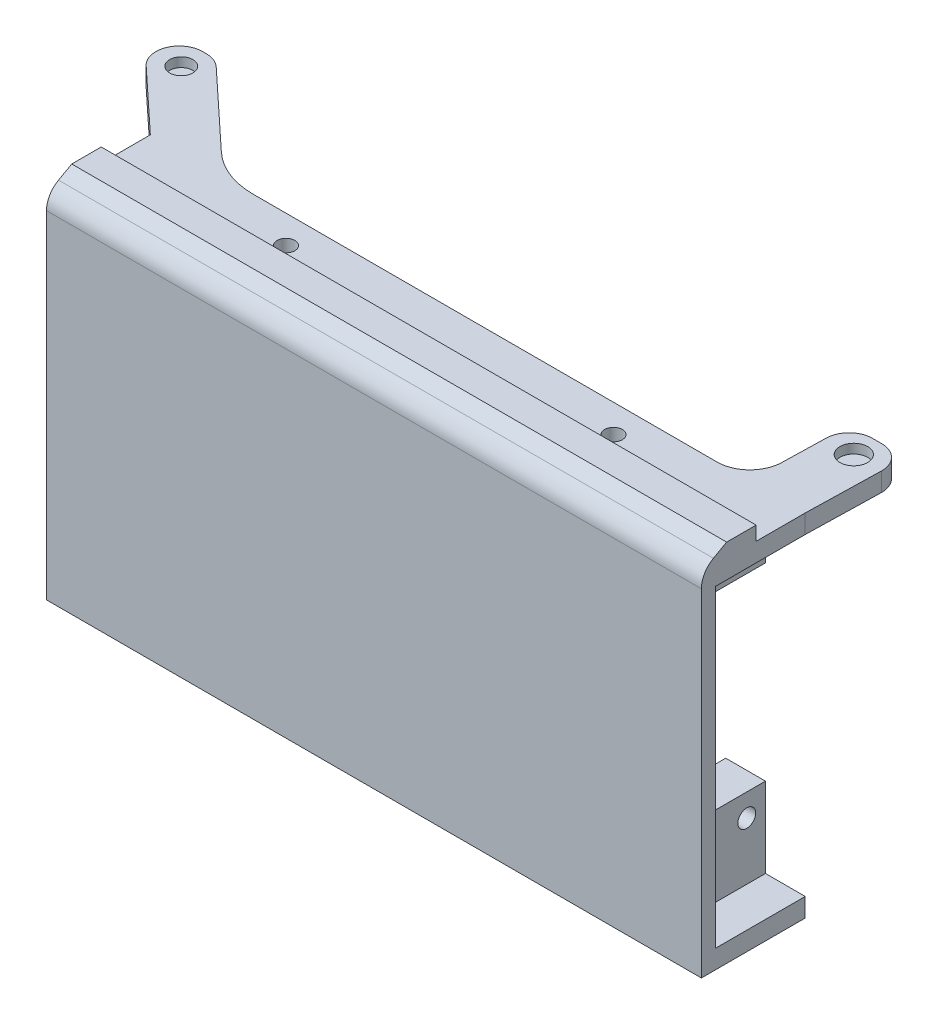
from build123d import *
from OCP.BRepFilletAPI import BRepFilletAPI_MakeChamfer

# Parameters (mm, degrees)
SKETCH1_W               = 140
SKETCH1_H               = 75
BOSS_EXTRUDE1_DEPTH     = 22.2
CUT_EXTRUDE1_DEPTH      = 19.2
CUT_EXTRUDE2_DEPTH      = 147.625679879
CUT_EXTRUDE2_DEPTH_BACK = 147.625679879
SKETCH3_R               = 1.9
CUT_EXTRUDE5_DEPTH      = 103.146169776
CUT_EXTRUDE5_DEPTH_BACK = 103.146169776
SKETCH9_R               = 1.9
BOSS_EXTRUDE6_DEPTH     = 4
FILLET2_R               = 5
BOSS_EXTRUDE10_DEPTH    = 140
FILLET5_R               = 5
SKETCH28_R              = 2.481859786
SKETCH28_R_2            = 2.963166916
CUT_EXTRUDE11_DEPTH     = 2
SKETCH27_R              = 4
SKETCH27_R_2            = 1.9
BOSS_EXTRUDE15_DEPTH    = 1.5
CHAMFER1_SIZE           = 1.5
CHAMFER1_SIZE_2         = 1
SKETCH29_R              = 4.5
SKETCH29_R_2            = 1.9
BOSS_EXTRUDE16_DEPTH    = 5.5
FILLET7_R               = 2


with BuildPart() as part:
    # Sketch1 → Boss-Extrude1 (new body)
    with BuildSketch(Plane.XY):
        Rectangle(SKETCH1_W, SKETCH1_H)
    extrude(amount=BOSS_EXTRUDE1_DEPTH)

    # Sketch2 → Cut-Extrude1 (cut)
    with BuildSketch(Plane(origin=(0, 0, 0), x_dir=(-1, 0, 0), z_dir=(0, 0, -1))):
        Polygon((-61.5, 24), (-53, 24), (-53, 33.5), (53, 33.5), (53, 24), (61.5, 24), (61.5, 33.5), (70, 33.5), (70, 20.2), (70, -20.2), (70, -33.5), (61.5, -33.5), (61.5, -16.4), (53, -16.4), (53, -33.5), (-53, -33.5), (-53, -16.4), (-61.5, -16.4), (-61.5, -33.5), (-70, -33.5), (-70, -20), (-70, 20), (-70, 33.5), (-61.5, 33.5), align=None)
    extrude(amount=-CUT_EXTRUDE1_DEPTH, mode=Mode.SUBTRACT)

    # Sketch3 → Cut-Extrude2 (cut, two sides: drawn at the far end of the back side and taken through both)
    with BuildSketch(Plane.ZY.offset(70).offset(-CUT_EXTRUDE2_DEPTH_BACK)):
        with Locations((14, 28.25)):
            Circle(SKETCH3_R)
        with Locations((4, 28.25)):
            Circle(SKETCH3_R)
        with Locations((4, -21.25)):
            Circle(SKETCH3_R)
        with Locations((14, -21.25)):
            Circle(SKETCH3_R)
    extrude(amount=CUT_EXTRUDE2_DEPTH + CUT_EXTRUDE2_DEPTH_BACK, mode=Mode.SUBTRACT)

    # Sketch9 → Cut-Extrude5 (cut, two sides: drawn at the far end of the back side and taken through both)
    with BuildSketch(Plane(origin=(0, -33.5, 0), x_dir=(1, 0, 0), z_dir=(0, 1, 0)).offset(-CUT_EXTRUDE5_DEPTH_BACK)):
        with Locations(Location((35, -6, 0), (0, 0, 270))):
            Circle(SKETCH9_R)
        with Locations(Location((-35, -6, 0), (0, 0, 90))):
            Circle(SKETCH9_R)
    extrude(amount=CUT_EXTRUDE5_DEPTH + CUT_EXTRUDE5_DEPTH_BACK, mode=Mode.SUBTRACT)

    # Sketch14 → Boss-Extrude6 (add)
    with BuildSketch(Plane(origin=(0, 37.5, 0), x_dir=(1, 0, 0), z_dir=(0, 1, 0))):
        with BuildLine():
            Line((-92.519742911, 21), (-70, 0))
            Line((-70, 0), (-48.085259489, 0))
            ThreePointArc((-48.085259489, 0), (-54.053646754, 1.133133727), (-59.191444218, 4.374842509))
            Line((-59.191444218, 4.374842509), (-77.019742911, 21))
            Line((-77.019742911, 21), (-92.519742911, 21))
        make_face()
        with BuildLine():
            Line((51.164682821, 0), (70, 0))
            Line((70, 0), (70.5, 21))
            Line((70.5, 21), (58.5, 21))
            Line((58.5, 21), (58.162699537, 6.833380554))
            ThreePointArc((58.162699537, 6.833380554), (56.055166635, 1.991690099), (51.164682821, 0))
        make_face()
    extrude(amount=-BOSS_EXTRUDE6_DEPTH)

    # Fillet2
    fillet2_edges = [part.edges().sort_by_distance(p)[0] for p in [
        (-92.519742911, 35.5, -21),
        (-77.019742911, 35.5, -21),
        (58.5, 35.5, -21),
        (70.5, 35.5, -21),
    ]]
    fillet(fillet2_edges, radius=FILLET2_R)

    # Sketch19 → Boss-Extrude10 (add)
    with BuildSketch(Plane.ZY.offset(70)):
        Polygon((10.5, 37.5), (22.2, 37.5), (16.799018003, 40.5), (10.5, 40.5), align=None)
    extrude(amount=-BOSS_EXTRUDE10_DEPTH)

    # Fillet5
    fillet5_edges = [part.edges().sort_by_distance(p)[0] for p in [
        (0, 37.5, 22.2),
    ]]
    fillet(fillet5_edges, radius=FILLET5_R)

    # Sketch28 → Cut-Extrude11 (cut)
    with BuildSketch(Plane(origin=(0, 37.5, 0), x_dir=(1, 0, 0), z_dir=(0, 1, 0))):
        with Locations(Location((-79.386619677, 16, 0), (0, 0, 270))):
            Circle(SKETCH28_R)
        with Locations(Location((64.379251942, 16, 0), (0, 0, 270))):
            Circle(SKETCH28_R_2)
    extrude(amount=-CUT_EXTRUDE11_DEPTH, mode=Mode.SUBTRACT)

    # Sketch27 → Boss-Extrude15 (add)
    # profile 1 of 2: a face of its own
    with BuildSketch(Plane(origin=(0, -33.5, 0), x_dir=(1, 0, 0), z_dir=(0, 1, 0))):
        with Locations(Location((35, -6, 0), (0, 0, 90))):
            Circle(SKETCH27_R)
        with Locations(Location((35, -6, 0), (0, 0, 270))):
            Circle(SKETCH27_R_2, mode=Mode.SUBTRACT)
    # profile 2 of 2: a face of its own
    with BuildSketch(Plane(origin=(0, -33.5, 0), x_dir=(1, 0, 0), z_dir=(0, 1, 0))):
        with Locations(Location((-35, -6, 0), (0, 0, 90))):
            Circle(SKETCH27_R)
        with Locations(Location((-35, -6, 0), (0, 0, 270))):
            Circle(SKETCH27_R_2, mode=Mode.SUBTRACT)
    extrude(amount=BOSS_EXTRUDE15_DEPTH)

    # Chamfer1
    chamfer1_edges_1 = [part.edges().sort_by_distance(p)[0] for p in [
        (35, -32, 10),
    ]]
    chamfer1_side_1 = [part.faces().sort_by_distance(p)[0] for p in [
        (35, -32.02, 10),
    ]]
    chamfer1_edges_2 = [part.edges().sort_by_distance(p)[0] for p in [
        (-35, -32, 10),
    ]]
    chamfer1_side_2 = [part.faces().sort_by_distance(p)[0] for p in [
        (-35, -32.02, 10),
    ]]
    chamfer1 = BRepFilletAPI_MakeChamfer(part.part.solid().wrapped)
    for e in chamfer1_edges_1:
        chamfer1.Add(CHAMFER1_SIZE - 0.0001, CHAMFER1_SIZE_2 - 0.0001, e.wrapped, chamfer1_side_1[0].wrapped)
    for e in chamfer1_edges_2:
        chamfer1.Add(CHAMFER1_SIZE - 0.0001, CHAMFER1_SIZE_2 - 0.0001, e.wrapped, chamfer1_side_2[0].wrapped)
    add(Compound.cast(chamfer1.Shape()), mode=Mode.REPLACE)  # a hair under: the kernel refuses the full size

    # Sketch29 → Boss-Extrude16 (add)
    # profile 1 of 2: a face of its own
    with BuildSketch(Plane(origin=(0, 0, 19.2), x_dir=(-1, 0, 0), z_dir=(0, 0, -1))):
        with Locations((0, 22.5)):
            Circle(SKETCH29_R)
        with Locations((0, 22.5)):
            Circle(SKETCH29_R_2, mode=Mode.SUBTRACT)
    # profile 2 of 2: a face of its own
    with BuildSketch(Plane(origin=(0, 0, 19.2), x_dir=(-1, 0, 0), z_dir=(0, 0, -1))):
        with Locations((0, -22.5)):
            Circle(SKETCH29_R)
        with Locations((0, -22.5)):
            Circle(SKETCH29_R_2, mode=Mode.SUBTRACT)
    extrude(amount=BOSS_EXTRUDE16_DEPTH)

    # Fillet7
    fillet7_edges = [part.edges().sort_by_distance(p)[0] for p in [
        (4.5, 22.5, 19.2),
        (4.5, -22.5, 19.2),
    ]]
    fillet(fillet7_edges, radius=FILLET7_R)


solid = part.part
